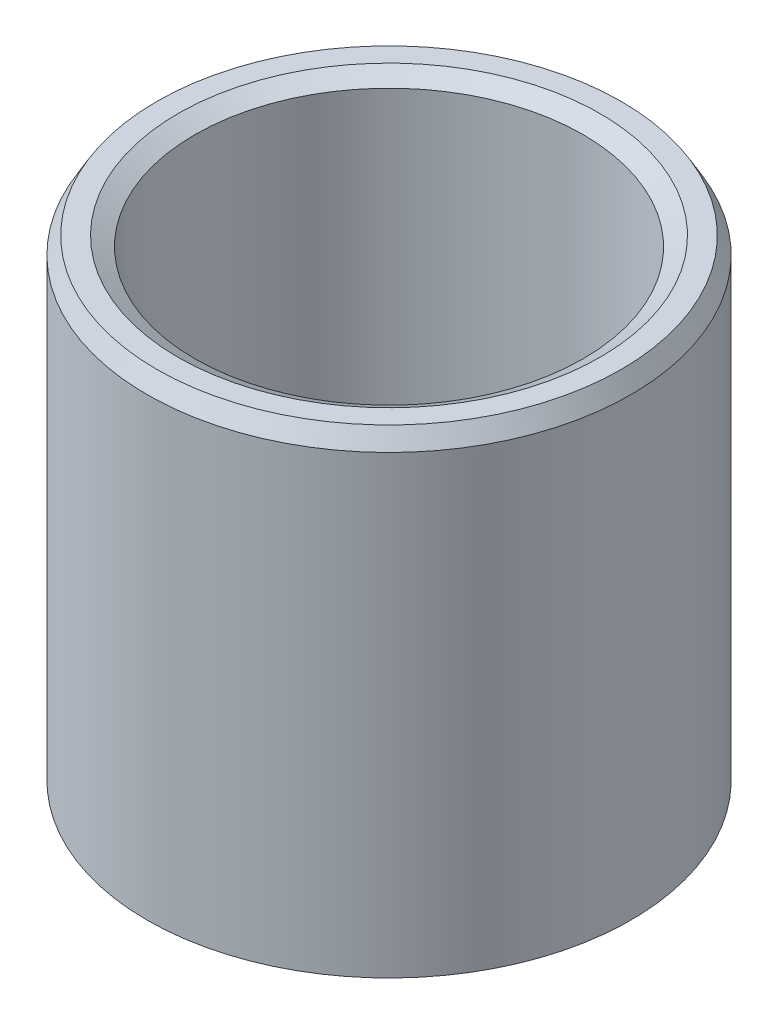
from build123d import *
from OCP.BRepFilletAPI import BRepFilletAPI_MakeChamfer

# Parameters (mm, degrees)
SKETCH1_R           = 52.5
BOSS_EXTRUDE1_DEPTH = 104.554395297
SKETCH2_R           = 42.130958524
CUT_EXTRUDE1_DEPTH  = 129.234634854
CHAMFER1_SIZE       = 3.672800297
CHAMFER1_SIZE2      = 2.12049224


with BuildPart() as part:
    # Sketch1 → Boss-Extrude1 (new body)
    with BuildSketch(Plane(origin=(0, 0, 0), x_dir=(1, 0, 0), z_dir=(0, 1, 0))):
        Circle(SKETCH1_R)
    extrude(amount=BOSS_EXTRUDE1_DEPTH)

    # Sketch2 → Cut-Extrude1 (cut, through all)
    with BuildSketch(Plane(origin=(0, 0, 0), x_dir=(1, 0, 0), z_dir=(0, 1, 0))):
        Circle(SKETCH2_R)
    extrude(amount=CUT_EXTRUDE1_DEPTH, mode=Mode.SUBTRACT)

    # Chamfer1: one chamfer whose edges measure the first distance from different faces: ONE call of the kernel's chamfer builder (chamfer() names one face for all edges)
    chamfer1_edges_1 = [part.edges().sort_by_distance(p)[0] for p in [
        (-42.130958524, 104.554395297, 0),
    ]]
    chamfer1_side_1 = [part.faces().sort_by_distance(p)[0] for p in [
        (-51.01507576, 104.554395297, 0),
    ]]
    chamfer1_edges_2 = [part.edges().sort_by_distance(p)[0] for p in [
        (-42.130958524, 0, 0),
    ]]
    chamfer1_side_2 = [part.faces().sort_by_distance(p)[0] for p in [
        (-42.130958524, 52.277197649, 0),
    ]]
    chamfer1_edges_3 = [part.edges().sort_by_distance(p)[0] for p in [
        (-52.5, 0, 0),
    ]]
    chamfer1_side_3 = [part.faces().sort_by_distance(p)[0] for p in [
        (-51.01507576, 0, 0),
    ]]
    chamfer1_edges_4 = [part.edges().sort_by_distance(p)[0] for p in [
        (-52.5, 104.554395297, 0),
    ]]
    chamfer1_side_4 = [part.faces().sort_by_distance(p)[0] for p in [
        (-52.5, 52.277197649, 0),
    ]]
    chamfer1 = BRepFilletAPI_MakeChamfer(part.part.solid().wrapped)
    for e in chamfer1_edges_1:
        chamfer1.Add(CHAMFER1_SIZE, CHAMFER1_SIZE2, e.wrapped, chamfer1_side_1[0].wrapped)  # the first distance lies on this face
    for e in chamfer1_edges_2:
        chamfer1.Add(CHAMFER1_SIZE, CHAMFER1_SIZE2, e.wrapped, chamfer1_side_2[0].wrapped)  # the first distance lies on this face
    for e in chamfer1_edges_3:
        chamfer1.Add(CHAMFER1_SIZE, CHAMFER1_SIZE2, e.wrapped, chamfer1_side_3[0].wrapped)  # the first distance lies on this face
    for e in chamfer1_edges_4:
        chamfer1.Add(CHAMFER1_SIZE, CHAMFER1_SIZE2, e.wrapped, chamfer1_side_4[0].wrapped)  # the first distance lies on this face
    add(Compound.cast(chamfer1.Shape()), mode=Mode.REPLACE)


solid = part.part
